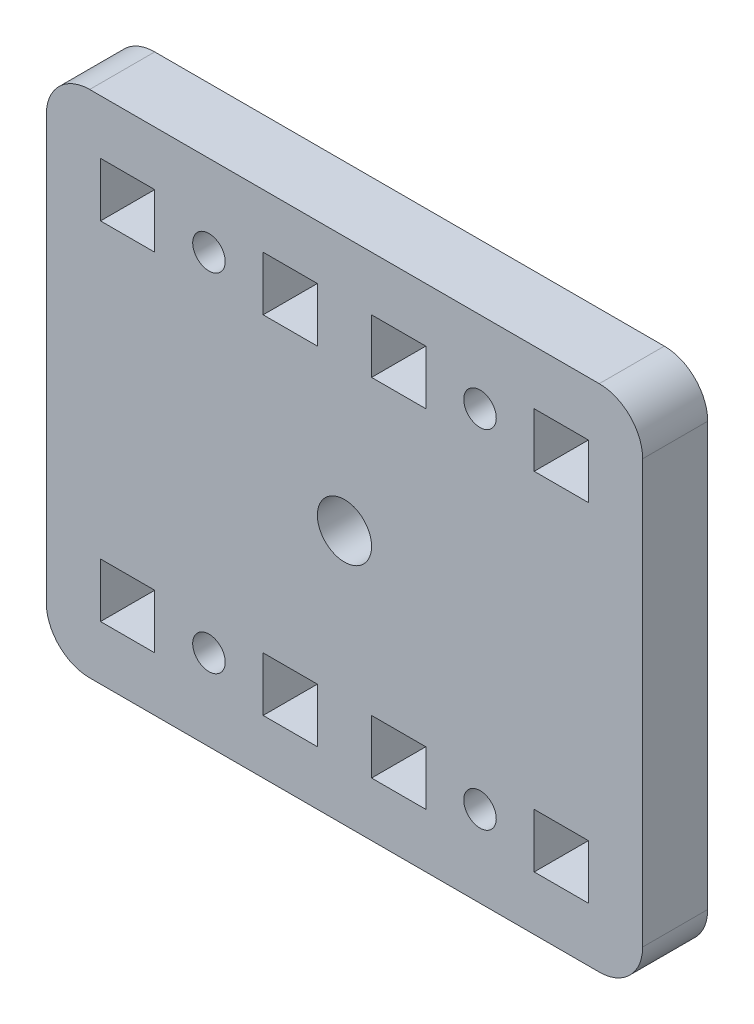
from build123d import *

# Parameters (mm, degrees)
BOSS_EXTRU_1_OUTLINE_W   = 55
BOSS_EXTRU_1_OUTLINE_H   = 47
BOSS_EXTRU_1_OUTLINE_W_2 = 5
BOSS_EXTRU_1_OUTLINE_H_2 = 5
BOSS_EXTRU_1_OUTLINE_R   = 1.5
BOSS_EXTRU_1_OUTLINE_R_2 = 2.5
BOSS_EXTRU_1_DEPTH       = 6
CONG_1_R                 = 4


# Read off the part's stored shape, not the designer's step: Boss.-Extru.1
with BuildPart() as part:
    # Boss.-Extru.1 outline → Boss.-Extru.1 (new body)
    with BuildSketch(Plane.XY):
        Rectangle(BOSS_EXTRU_1_OUTLINE_W, BOSS_EXTRU_1_OUTLINE_H)
        with Locations((-20, -16)):
            Rectangle(BOSS_EXTRU_1_OUTLINE_W_2, BOSS_EXTRU_1_OUTLINE_H_2, mode=Mode.SUBTRACT)
        with Locations((-12.5, -16)):
            Circle(BOSS_EXTRU_1_OUTLINE_R, mode=Mode.SUBTRACT)
        with Locations((-5, -16)):
            Rectangle(BOSS_EXTRU_1_OUTLINE_W_2, BOSS_EXTRU_1_OUTLINE_H_2, mode=Mode.SUBTRACT)
        with Locations((5, -16)):
            Rectangle(BOSS_EXTRU_1_OUTLINE_W_2, BOSS_EXTRU_1_OUTLINE_H_2, mode=Mode.SUBTRACT)
        with Locations((12.5, -16)):
            Circle(BOSS_EXTRU_1_OUTLINE_R, mode=Mode.SUBTRACT)
        with Locations((20, -16)):
            Rectangle(BOSS_EXTRU_1_OUTLINE_W_2, BOSS_EXTRU_1_OUTLINE_H_2, mode=Mode.SUBTRACT)
        with Locations((-20, 16)):
            Rectangle(BOSS_EXTRU_1_OUTLINE_W_2, BOSS_EXTRU_1_OUTLINE_H_2, mode=Mode.SUBTRACT)
        with Locations((-12.5, 16)):
            Circle(BOSS_EXTRU_1_OUTLINE_R, mode=Mode.SUBTRACT)
        with Locations((-5, 16)):
            Rectangle(BOSS_EXTRU_1_OUTLINE_W_2, BOSS_EXTRU_1_OUTLINE_H_2, mode=Mode.SUBTRACT)
        Circle(BOSS_EXTRU_1_OUTLINE_R_2, mode=Mode.SUBTRACT)
        with Locations((5, 16)):
            Rectangle(BOSS_EXTRU_1_OUTLINE_W_2, BOSS_EXTRU_1_OUTLINE_H_2, mode=Mode.SUBTRACT)
        with Locations((12.5, 16)):
            Circle(BOSS_EXTRU_1_OUTLINE_R, mode=Mode.SUBTRACT)
        with Locations((20, 16)):
            Rectangle(BOSS_EXTRU_1_OUTLINE_W_2, BOSS_EXTRU_1_OUTLINE_H_2, mode=Mode.SUBTRACT)
    extrude(amount=BOSS_EXTRU_1_DEPTH)

    # Congé1
    cong_1_edges = [part.edges().sort_by_distance(p)[0] for p in [
        (-27.5, 23.5, 3),
        (27.5, 23.5, 3),
        (27.5, -23.5, 3),
        (-27.5, -23.5, 3),
    ]]
    fillet(cong_1_edges, radius=CONG_1_R)


solid = part.part
